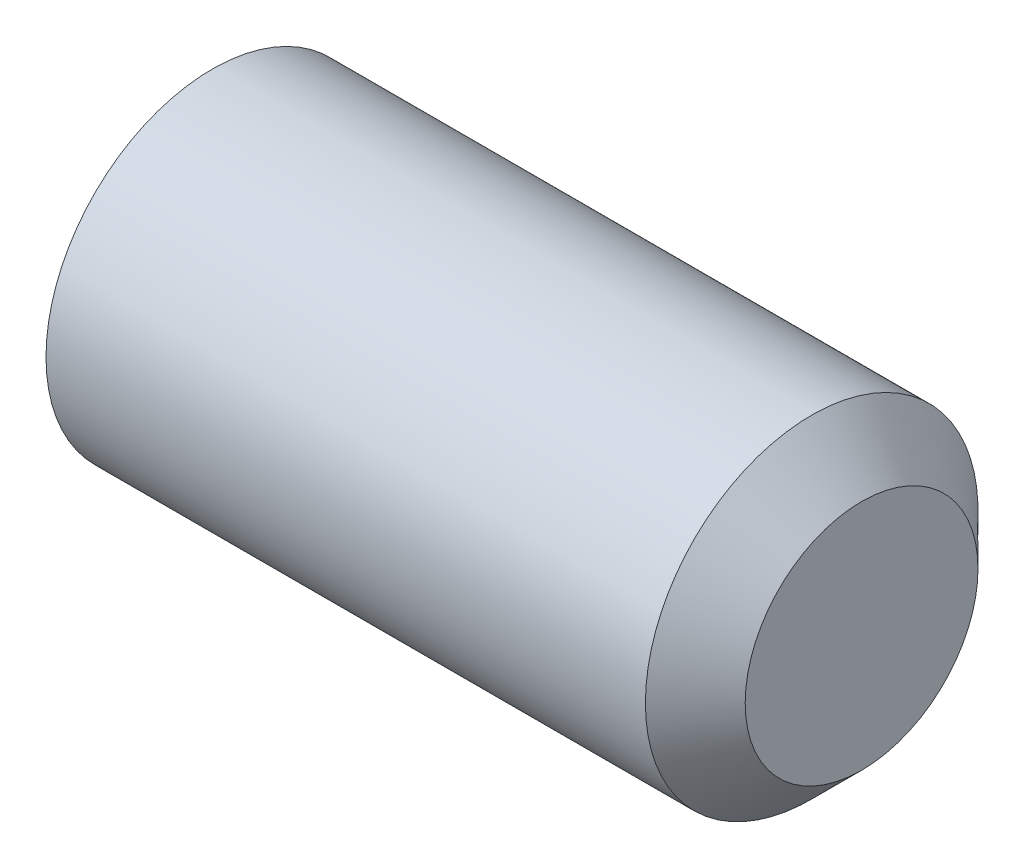
from build123d import *

# Parameters (mm, degrees)
HEX_2_DEPTH = 5


with BuildPart() as part:
    # BodySke → BaseBody (revolve)
    with BuildSketch(Plane.XY):
        Polygon((0, 0), (0, 4.172), (0.478046023, 5), (18.5, 5), (20, 3.5), (20, 0), align=None)
    revolve(axis=Axis((-12.7, 0, 0), (1, 0, 0)))

    # Sketch2 → Hex 2 (cut)
    with BuildSketch(Plane.ZY):
        Polygon((1.443375673, 2.5), (-1.443375673, 2.5), (-2.886751346, 0), (-1.443375673, -2.5), (1.443375673, -2.5), (2.886751346, 0), align=None)
    extrude(amount=-HEX_2_DEPTH, mode=Mode.SUBTRACT)


solid = part.part
